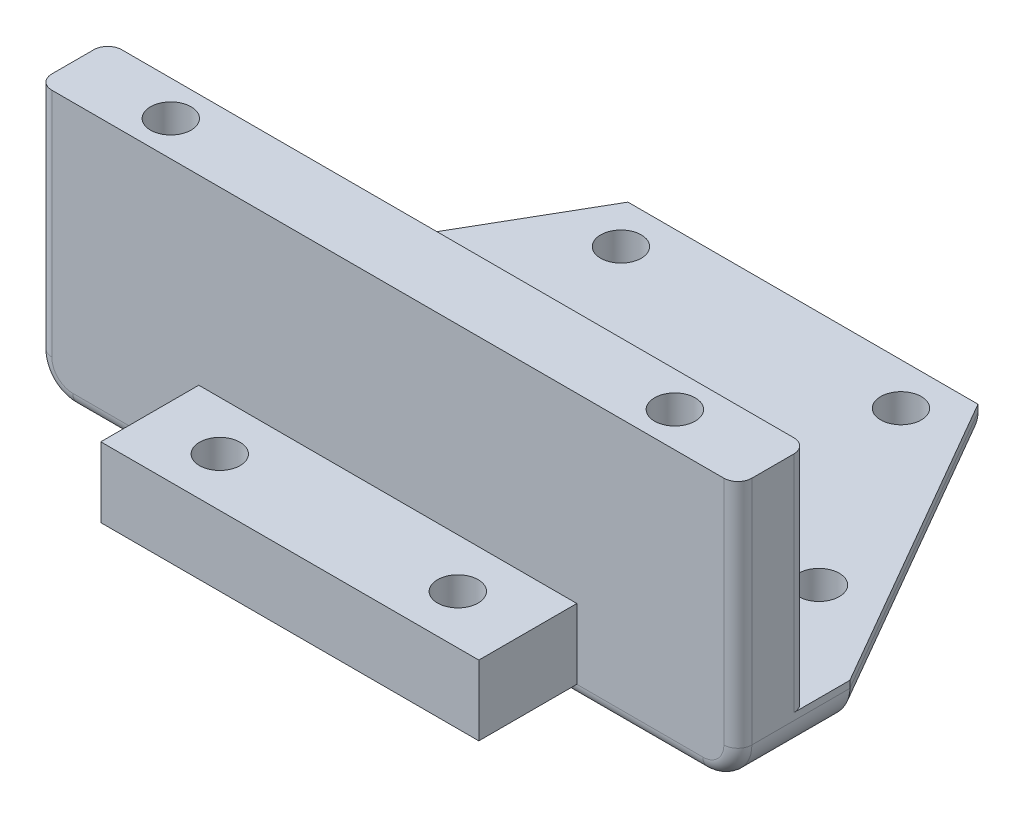
from build123d import *

# Parameters (mm, degrees)
EXTRUDE_1_DEPTH     = 3
SKETCH_2_R          = 1.45
CUT_EXTRUDE_1_DEPTH = 3
SKETCH_3_W          = 50
SKETCH_3_H          = 3
EXTRUDE_2_DEPTH     = 8
SKETCH_4_W          = 50
SKETCH_4_H          = 5
EXTRUDE_3_DEPTH     = 16
SKETCH_6_W          = 27
SKETCH_6_H          = 5
EXTRUDE_4_DEPTH     = 7
SKETCH_7_R          = 1.45
CUT_EXTRUDE_2_DEPTH = 7
SKETCH_8_R          = 3
CUT_EXTRUDE_3_DEPTH = 2
FILLET_1_R          = 1
FILLET_2_R          = 2.5
SKETCH_9_R          = 1.45
CUT_EXTRUDE_4_DEPTH = 10


# Some blends are built 0.0001 mm under size
with BuildPart() as part:
    # Эскиз1 → Бобышка-Вытянуть1 (new body)
    with BuildSketch(Plane(origin=(0, 0, 0), x_dir=(1, 0, 0), z_dir=(0, 1, 0))):
        Polygon((-25, 0), (-12.5, 21.650635095), (12.5, 21.650635095), (25, 0), align=None)
    extrude(amount=EXTRUDE_1_DEPTH)

    # Эскиз2 → Вырез-Вытянуть1 (cut)
    with BuildSketch(Plane(origin=(0, 3, 0), x_dir=(1, 0, 0), z_dir=(0, 1, 0))):
        with Locations(Location((-10, 18.650635095, 0), (0, 0, 270))):
            Circle(SKETCH_2_R)
        with Locations(Location((-18, 4.794228634, 0), (0, 0, 270))):
            Circle(SKETCH_2_R)
        with Locations(Location((18, 4.794228634, 0), (0, 0, 90))):
            Circle(SKETCH_2_R)
        with Locations(Location((10, 18.650635095, 0), (0, 0, 90))):
            Circle(SKETCH_2_R)
        with Locations(Location((-6, 4.794228634, 0), (0, 0, 270))):
            Circle(SKETCH_2_R)
        with Locations(Location((6, 4.794228634, 0), (0, 0, 270))):
            Circle(SKETCH_2_R)
    extrude(amount=-CUT_EXTRUDE_1_DEPTH, mode=Mode.SUBTRACT)

    # Эскиз3 → Бобышка-Вытянуть2 (add)
    with BuildSketch(Plane.XY):
        with Locations((0, 1.5)):
            Rectangle(SKETCH_3_W, SKETCH_3_H)
    extrude(amount=EXTRUDE_2_DEPTH)

    # Эскиз4 → Бобышка-Вытянуть3 (add)
    with BuildSketch(Plane(origin=(0, 3, 0), x_dir=(1, 0, 0), z_dir=(0, 1, 0))):
        with Locations((0, -5.5)):
            Rectangle(SKETCH_4_W, SKETCH_4_H)
    extrude(amount=EXTRUDE_3_DEPTH)

    # Эскиз6 → Бобышка-Вытянуть4 (add)
    with BuildSketch(Plane.XY.offset(8)):
        with Locations((0, 3.5)):
            Rectangle(SKETCH_6_W, SKETCH_6_H)
    extrude(amount=EXTRUDE_4_DEPTH)

    # Эскиз7 → Вырез-Вытянуть2 (cut)
    with BuildSketch(Plane.XZ.offset(-1)):
        with Locations(Location((-8.5, 11.5, 0), (0, 0, 270))):
            Circle(SKETCH_7_R)
        with Locations(Location((8.5, 11.5, 0), (0, 0, 270))):
            Circle(SKETCH_7_R)
    extrude(amount=-CUT_EXTRUDE_2_DEPTH, mode=Mode.SUBTRACT)

    # Эскиз8 → Вырез-Вытянуть3 (cut)
    with BuildSketch(Plane.XZ.offset(-1)):
        with Locations(Location((-8.5, 11.5, 0), (0, 0, 270))):
            Circle(SKETCH_8_R)
        with Locations(Location((8.5, 11.5, 0), (0, 0, 270))):
            Circle(SKETCH_8_R)
    extrude(amount=-CUT_EXTRUDE_3_DEPTH, mode=Mode.SUBTRACT)

    # Скругление1
    fillet_1_edges = [part.edges().sort_by_distance(p)[0] for p in [
        (25, 9.5, 8),
        (-25, 9.5, 8),
        (0, 0, 8),
        (-25, 11, 3),
        (25, 11, 3),
    ]]
    fillet(fillet_1_edges, radius=FILLET_1_R - 0.0001)  # a hair under: the kernel refuses the full size

    # Скругление2
    # the kernel refuses this fillet: 2.5 mm, written as the material it takes off along each edge
    with BuildSketch(Plane(origin=(22.5, 2.5, 8), x_dir=(0, -1, 0), z_dir=(-1, 0, 0))) as fillet_2_piece_1:
        with BuildLine():
            CenterArc((1.5001, -0.9999), 0.9999, 0, 90)
            Line((2.5, -0.9999), (2.5, 0))
            Line((2.5, 0), (1.5001, 0))
        make_face()
    revolve(axis=Axis((22.5, 2.5, 8), (0, 0, 1)), revolution_arc=90, mode=Mode.SUBTRACT)
    with BuildSketch(Plane(origin=(-22.5, 2.5, 8), x_dir=(-1, 0, 0), z_dir=(0, 1, 0))) as fillet_2_piece_2:
        with BuildLine():
            CenterArc((1.5001, -0.9999), 0.9999, 0, 90)
            Line((2.5, -0.9999), (2.5, 0))
            Line((2.5, 0), (1.5001, 0))
        make_face()
    revolve(axis=Axis((-22.5, 2.5, 8), (0, 0, 1)), revolution_arc=90, mode=Mode.SUBTRACT)
    with BuildSketch(Plane(origin=(25, 0, -6.25), x_dir=(0, 1, 0), z_dir=(0, 0, 1))) as fillet_2_piece_3:
        with BuildLine():
            CenterArc((FILLET_2_R, FILLET_2_R), FILLET_2_R, 180, 90)
            Line((0, FILLET_2_R), (0, 0))
            Line((0, 0), (FILLET_2_R, 0))
        make_face()
    extrude(amount=14.25, mode=Mode.SUBTRACT)
    with BuildSketch(Plane(origin=(-25, 0, -6.25), x_dir=(0, 1, 0), z_dir=(0, 0, 1))) as fillet_2_piece_4:
        with BuildLine():
            CenterArc((FILLET_2_R, -FILLET_2_R), FILLET_2_R, 90, 90)
            Line((0, -FILLET_2_R), (0, 0))
            Line((0, 0), (FILLET_2_R, 0))
        make_face()
    extrude(amount=14.25, mode=Mode.SUBTRACT)
    with BuildSketch(Plane(origin=(-28.125, 0, 5.412658774), x_dir=(0, 1, 0), z_dir=(0.5000000000000041, 0, -0.8660254037844364)), Plane(origin=(-18.75, 0, -21.650635095), x_dir=(0, 1, 0), z_dir=(1, 0, 0)), Plane(origin=(9.375, 0, -27.063293868), x_dir=(0, 1, 0), z_dir=(0.5000000000000041, 0, 0.8660254037844364))) as fillet_2_piece_5:
        with BuildLine():
            CenterArc((FILLET_2_R, FILLET_2_R), FILLET_2_R, 180, 90)
            Line((0, FILLET_2_R), (0, 0))
            Line((0, 0), (FILLET_2_R, 0))
        make_face()
    extrude(amount=37.5, mode=Mode.SUBTRACT)

    # Эскиз9 → Вырез-Вытянуть4 (cut)
    with BuildSketch(Plane(origin=(0, 19, 0), x_dir=(1, 0, 0), z_dir=(0, 1, 0))):
        with Locations(Location((-18, -5.5, 0), (0, 0, 270))):
            Circle(SKETCH_9_R)
        with Locations(Location((18, -5.5, 0), (0, 0, 270))):
            Circle(SKETCH_9_R)
    extrude(amount=-CUT_EXTRUDE_4_DEPTH, mode=Mode.SUBTRACT)


solid = part.part
